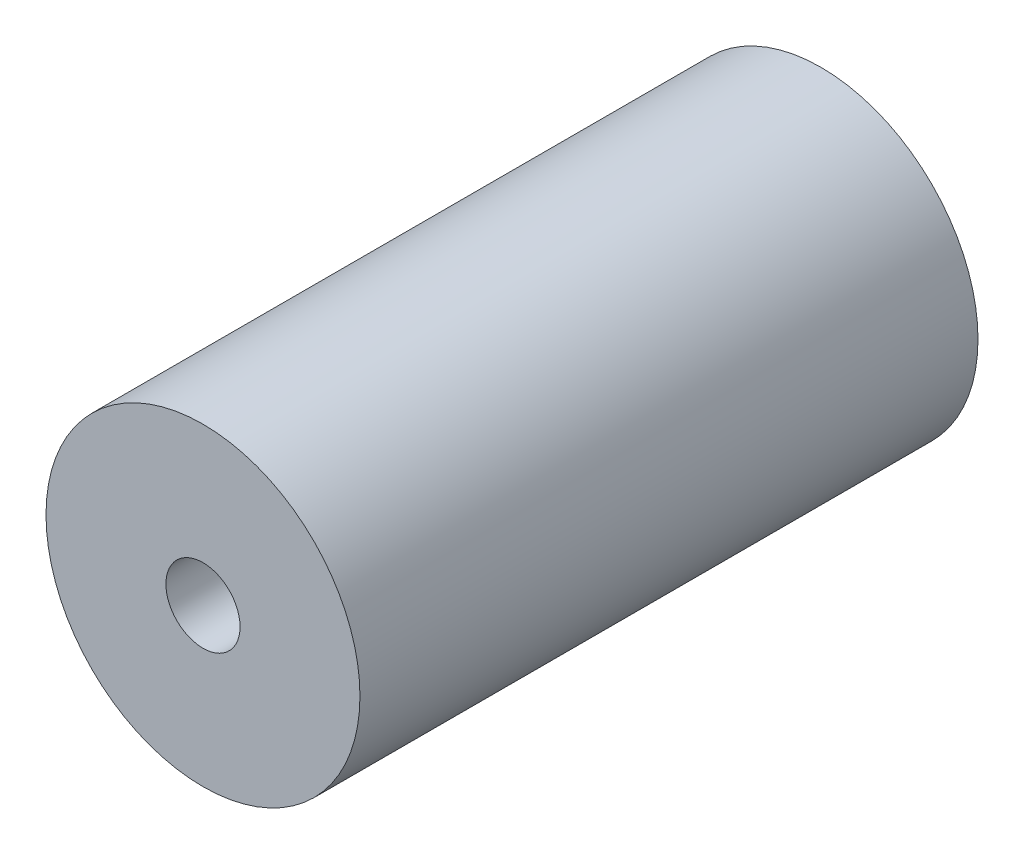
from build123d import *

# Parameters (mm, degrees)
SKETCH1_R           = 12.7
SKETCH1_R_2         = 3
BOSS_EXTRUDE1_DEPTH = 50


with BuildPart() as part:
    # Sketch1 → Boss-Extrude1 (new body)
    with BuildSketch(Plane.XY):
        Circle(SKETCH1_R)
        Circle(SKETCH1_R_2, mode=Mode.SUBTRACT)
    extrude(amount=BOSS_EXTRUDE1_DEPTH)


solid = part.part
